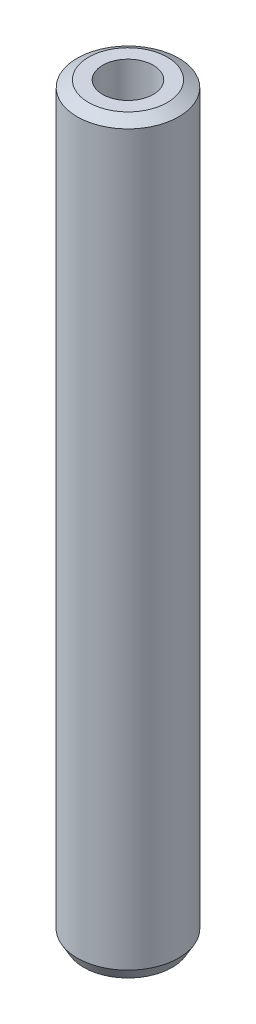
from build123d import *
from OCP.BRepFilletAPI import BRepFilletAPI_MakeChamfer

# Parameters (mm, degrees)
SKETCH1_R           = 12.5
BOSS_EXTRUDE1_DEPTH = 183.758441967
SKETCH2_R           = 6.232076178
CUT_EXTRUDE1_DEPTH  = 185.6067848
CHAMFER1_SIZE       = 1.627295794
CHAMFER1_SIZE2      = 2.818558994


with BuildPart() as part:
    # Sketch1 → Boss-Extrude1 (new body)
    with BuildSketch(Plane(origin=(0, 0, 0), x_dir=(1, 0, 0), z_dir=(0, 1, 0))):
        Circle(SKETCH1_R)
    extrude(amount=BOSS_EXTRUDE1_DEPTH)

    # Sketch2 → Cut-Extrude1 (cut, through all)
    with BuildSketch(Plane(origin=(0, 0, 0), x_dir=(1, 0, 0), z_dir=(0, 1, 0))):
        Circle(SKETCH2_R)
    extrude(amount=CUT_EXTRUDE1_DEPTH, mode=Mode.SUBTRACT)

    # Chamfer1: one chamfer whose edges measure the first distance from different faces: ONE call of the kernel's chamfer builder (chamfer() names one face for all edges)
    chamfer1_edges_1 = [part.edges().sort_by_distance(p)[0] for p in [
        (-12.5, 183.758441967, 0),
    ]]
    chamfer1_side_1 = [part.faces().sort_by_distance(p)[0] for p in [
        (-12.5, 91.879220984, 0),
    ]]
    chamfer1_edges_2 = [part.edges().sort_by_distance(p)[0] for p in [
        (-12.5, 0, 0),
    ]]
    chamfer1_side_2 = [part.faces().sort_by_distance(p)[0] for p in [
        (-12.146446609, 0, 0),
    ]]
    chamfer1 = BRepFilletAPI_MakeChamfer(part.part.solid().wrapped)
    for e in chamfer1_edges_1:
        chamfer1.Add(CHAMFER1_SIZE, CHAMFER1_SIZE2, e.wrapped, chamfer1_side_1[0].wrapped)  # the first distance lies on this face
    for e in chamfer1_edges_2:
        chamfer1.Add(CHAMFER1_SIZE, CHAMFER1_SIZE2, e.wrapped, chamfer1_side_2[0].wrapped)  # the first distance lies on this face
    add(Compound.cast(chamfer1.Shape()), mode=Mode.REPLACE)


solid = part.part
